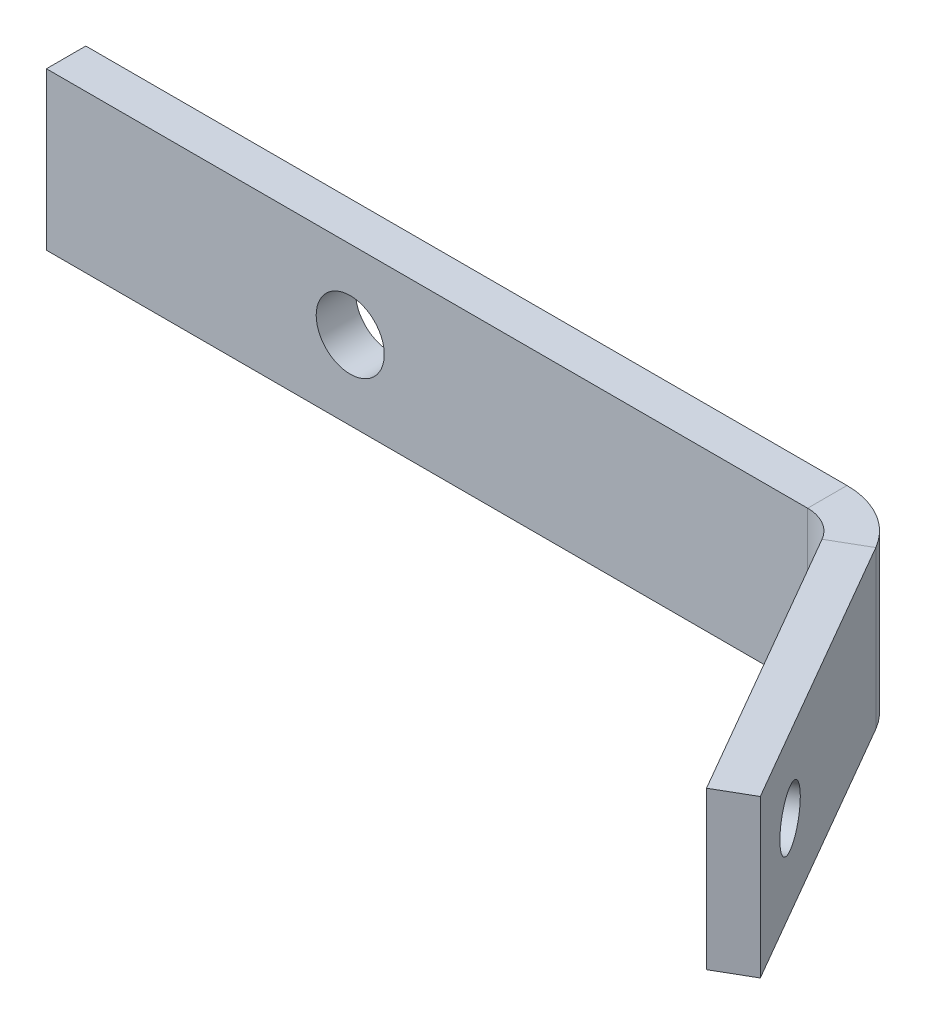
from build123d import *

# Parameters (mm, degrees)
ESBO_O1_W               = 92
ESBO_O1_H               = 12.7
FLANGE_BASE1_DEPTH      = 3.18
DOBRA_START             = -6.35
DOBRA_ESBO_ADA1_DEPTH   = 12.7
DOBRA_ESBO_ADA1_2_DEPTH = 12.7
ESBO_O8_R               = 2.75
CORTE_EXTRUS_O1_DEPTH   = 10
ESBO_O10_R              = 2.25
CORTE_EXTRUS_O3_DEPTH   = 10


# Read off the part's stored shape, not the designer's step: Dobra esboçada1
# Sheet-metal steps are written as plain solids
with BuildPart() as part:
    # Esboço1 → Flange-base1 (new body)
    with BuildSketch(Plane.XY):
        Rectangle(ESBO_O1_W, ESBO_O1_H)
    extrude(amount=-FLANGE_BASE1_DEPTH)

    # Dobra esboçada1 outline → Dobra esboçada1 (cut)
    with BuildSketch(Plane(origin=(0, 0, 0), x_dir=(1, 0, 0), z_dir=(0, 1, 0)).offset(DOBRA_START)):
        with BuildLine():
            ThreePointArc((15.50243384, 3.18), (18.68243384, 2.327921568), (21.010355408, 0))
            Line((21.010355408, 0), (46, 0))
            Line((46, 0), (46, 3.18))
            Line((46, 3.18), (15.50243384, 3.18))
        make_face()
    extrude(amount=DOBRA_ESBO_ADA1_DEPTH, mode=Mode.SUBTRACT)

    # Dobra esbo_ada1 2 outline → Dobra esbo_ada1 2 (add)
    with BuildSketch(Plane(origin=(0, 0, 0), x_dir=(1, 0, 0), z_dir=(0, 1, 0)).offset(DOBRA_START)):
        with BuildLine():
            Line((18.256394624, -1.59), (31.007611545, -23.675755564))
            Line((31.007611545, -23.675755564), (33.761572329, -22.085755564))
            Line((33.761572329, -22.085755564), (21.010355408, 0))
            Line((21.010355408, 0), (15.50243384, 0))
            ThreePointArc((15.50243384, 0), (17.09243384, -0.426039216), (18.256394624, -1.59))
        make_face()
    extrude(amount=DOBRA_ESBO_ADA1_2_DEPTH)

    # Esboço8 → Corte-extrusão1 (cut)
    with BuildSketch(Plane(origin=(0, 0, -3.18), x_dir=(-1, 0, 0), z_dir=(0, 0, -1))):
        with Locations((21.455259123, 0)):
            Circle(ESBO_O8_R)
    extrude(amount=-CORTE_EXTRUS_O1_DEPTH, mode=Mode.SUBTRACT)

    # Esboço10 → Corte-extrusão3 (cut)
    with BuildSketch(Plane(origin=(15.757766556, 0, -9.097750763), x_dir=(-0.49999999999999806, 0, -0.8660254037844398), z_dir=(0.8660254037844397, 0, -0.499999999999998))):
        with Locations((-29.427611545, 0.33)):
            Circle(ESBO_O10_R)
    extrude(amount=-CORTE_EXTRUS_O3_DEPTH, mode=Mode.SUBTRACT)


solid = part.part
